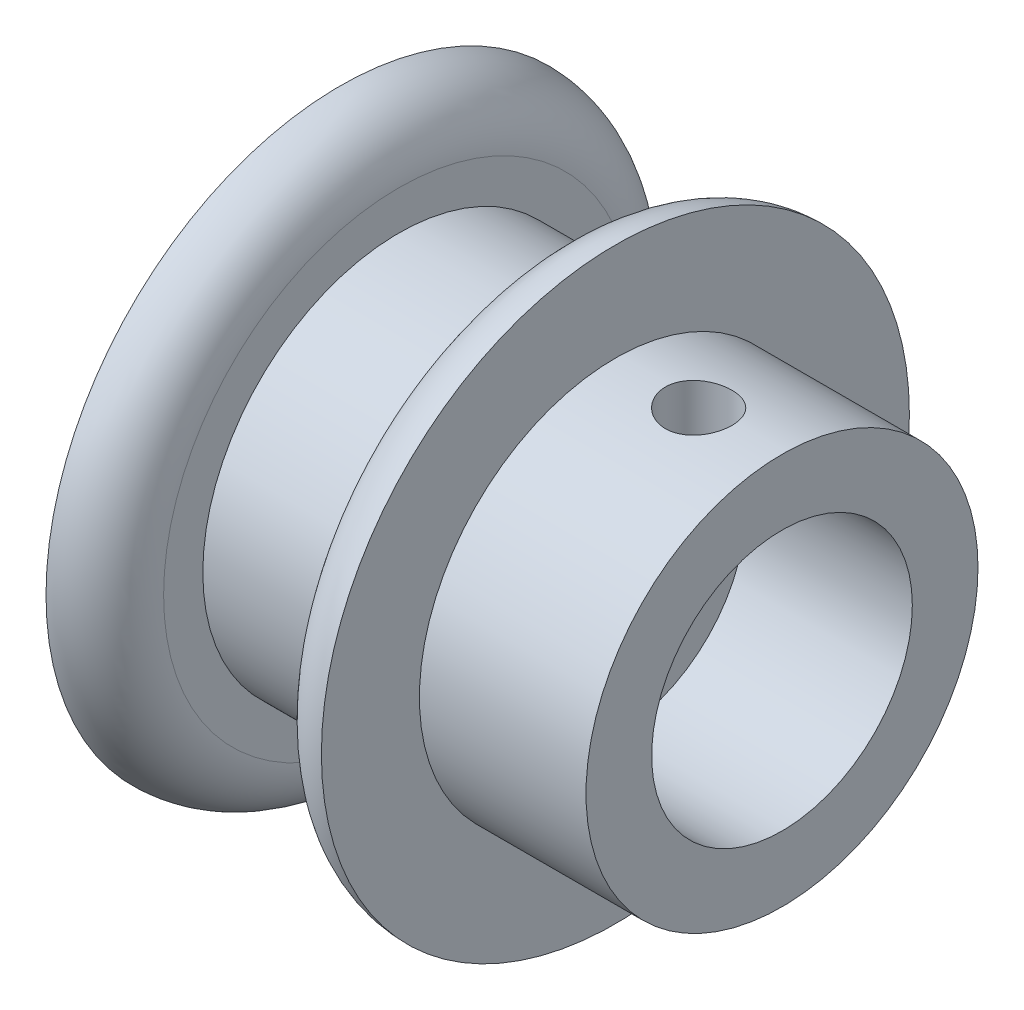
from build123d import *
from build123d.topology import SkipClean

# Parameters (mm, degrees)
EXTRUDE_3_DEPTH          = 14.35
EXTRUDE_START            = -3
EXTRUDE_7_DEPTH          = 3
EXTRUDE_8_DEPTH          = 3
EXTRUDE_START_2          = 10
EXTRUDE_9_DEPTH          = 10
EXTRUDE_10_DEPTH         = 10
CUT_EXTRUDE_1_DEPTH      = 10
CUT_EXTRUDE_2_DEPTH      = 14
FILLET_1_R               = 5
SKETCH_10_W              = 10.354719005
SKETCH_10_H              = 30
SKETCH_10_W_2            = 10.898600502
CUT_EXTRUDE_3_DEPTH      = 14
CUT_EXTRUDE_START        = -11.35
SKETCH_11_R              = 6.6
CUT_EXTRUDE_4_DEPTH      = 11.35
EXTRUDE_START_3          = -14.35
SKETCH_12_R              = 10
SKETCH_12_R_2            = 6.6
EXTRUDE_11_DEPTH         = 14.35
SKETCH_13_R              = 15
SKETCH_13_R_2            = 10
EXTRUDE_12_DEPTH         = 3
SKETCH_14_R              = 15
SKETCH_14_R_2            = 3.2
EXTRUDE_13_DEPTH         = 3
CUT_EXTRUDE_START_2      = -0.3
SKETCH_17_R              = 15
CUT_EXTRUDE_5_DEPTH      = 0.3
EXTRUDE_START_4          = 0.3
SKETCH_18_R              = 15
SKETCH_18_R_2            = 10
EXTRUDE_14_DEPTH         = 0.3
CUT_EXTRUDE_6_DEPTH      = 19.3
SKETCH_20_R              = 10
SKETCH_20_R_2            = 3.2
EXTRUDE_15_DEPTH         = 11.05
SKETCH_21_R              = 10
SKETCH_21_R_2            = 6.6
EXTRUDE_16_DEPTH         = 8.5
CUT_EXTRUDE_7_DEPTH      = 13.5
FILLET_2_R               = 3
CUT_EXTRUDE_9_DEPTH      = 10
CUT_EXTRUDE_9_DEPTH_BACK = 10
SKETCH_23_R              = 0.75
CUT_EXTRUDE_10_REACH     = 32.96
SKETCH_25_R              = 6.65


with BuildPart() as part:
    # Эскиз1 → Бобышка-Вытянуть3 (new body)
    with BuildSketch(Plane(origin=(0, 0, 0), x_dir=(0, 0, -1), z_dir=(1, 0, 0))):
        with BuildLine():
            ThreePointArc((-6.6, 0), (0, 6.6), (6.6, 0))
            Line((6.6, 0), (10, 0))
            ThreePointArc((10, 0), (0, 10), (-10, 0))
            Line((-10, 0), (-6.6, 0))
        make_face()
    extrude(amount=EXTRUDE_3_DEPTH)

    # Эскиз3 → Бобышка-Вытянуть7 (add)
    with BuildSketch(Plane(origin=(14.35, 0, 0), x_dir=(0, 0, -1), z_dir=(1, 0, 0)).offset(EXTRUDE_START)):
        with BuildLine():
            ThreePointArc((15, 0), (0, 15), (-15, 0))
            Line((-15, 0), (-10, 0))
            ThreePointArc((-10, 0), (0, 10), (10, 0))
            Line((10, 0), (15, 0))
        make_face()
        with BuildLine():
            ThreePointArc((6.6, 0), (0, 6.6), (-6.6, 0))
            Line((-6.6, 0), (-3.2, 0))
            ThreePointArc((-3.2, 0), (0, 3.2), (3.2, 0))
            Line((3.2, 0), (6.6, 0))
        make_face()
    extrude(amount=EXTRUDE_7_DEPTH)

    # Эскиз5 → Бобышка-Вытянуть8 (add)
    with BuildSketch(Plane.ZY):
        with BuildLine():
            ThreePointArc((15, 0), (0, 15), (-15, 0))
            Line((-15, 0), (-10, 0))
            ThreePointArc((-10, 0), (0, 10), (10, 0))
            Line((10, 0), (15, 0))
        make_face()
        with BuildLine():
            ThreePointArc((6.6, 0), (0, 6.6), (-6.6, 0))
            Line((-6.6, 0), (-3.2, 0))
            ThreePointArc((-3.2, 0), (0, 3.2), (3.2, 0))
            Line((3.2, 0), (6.6, 0))
        make_face()
    extrude(amount=-EXTRUDE_8_DEPTH)

    # Эскиз6 → Бобышка-Вытянуть9 (add)
    with BuildSketch(Plane.ZY.offset(EXTRUDE_START_2)):
        with BuildLine():
            ThreePointArc((-6.6, 0), (-6.41716127, 1.542738227), (-5.878775383, 3))
            Line((-5.878775383, 3), (-6.6, 3))
            Line((-6.6, 3), (-14.696938457, 3))
            Line((-14.696938457, 3), (-14.696938457, 0))
            Line((-14.696938457, 0), (-6.6, 0))
        make_face()
        with BuildLine():
            ThreePointArc((-3.2, 0), (-2.627105745, 1.827105745), (-1.113552873, 3))
            Line((-1.113552873, 3), (-5.878775383, 3))
            ThreePointArc((-5.878775383, 3), (-6.41716127, 1.542738227), (-6.6, 0))
            Line((-6.6, 0), (-3.2, 0))
        make_face()
        with BuildLine():
            Line((-5.878775383, 3), (-1.113552873, 3))
            ThreePointArc((-1.113552873, 3), (0, 3.2), (1.113552873, 3))
            Line((1.113552873, 3), (5.878775383, 3))
            ThreePointArc((5.878775383, 3), (0, 6.6), (-5.878775383, 3))
        make_face()
        with BuildLine():
            Line((5.878775383, 3), (1.113552873, 3))
            ThreePointArc((1.113552873, 3), (2.627105745, 1.827105745), (3.2, 0))
            Line((3.2, 0), (6.6, 0))
            ThreePointArc((6.6, 0), (6.41716127, 1.542738227), (5.878775383, 3))
        make_face()
        with BuildLine():
            Line((14.696938457, 3), (5.878775383, 3))
            ThreePointArc((5.878775383, 3), (6.41716127, 1.542738227), (6.6, 0))
            Line((6.6, 0), (14.696938457, 0))
            Line((14.696938457, 0), (14.696938457, 3))
        make_face()
    extrude(amount=-EXTRUDE_9_DEPTH)

    # Эскиз7 → Бобышка-Вытянуть10 (add)
    with BuildSketch(Plane(origin=(14.35, 0, 0), x_dir=(0, 0, -1), z_dir=(1, 0, 0))):
        with BuildLine():
            Line((6.6, 0), (14.696938457, 0))
            Line((14.696938457, 0), (14.696938457, 3))
            Line((14.696938457, 3), (5.878775383, 3))
            ThreePointArc((5.878775383, 3), (6.41716127, 1.542738227), (6.6, 0))
        make_face()
        with BuildLine():
            Line((3.2, 0), (6.6, 0))
            ThreePointArc((6.6, 0), (6.41716127, 1.542738227), (5.878775383, 3))
            ThreePointArc((5.878775383, 3), (0, 6.6), (-5.878775383, 3))
            ThreePointArc((-5.878775383, 3), (-6.41716127, 1.542738227), (-6.6, 0))
            Line((-6.6, 0), (-3.2, 0))
            ThreePointArc((-3.2, 0), (0, 3.2), (3.2, 0))
        make_face()
        with BuildLine():
            Line((-14.696938457, 0), (-6.6, 0))
            ThreePointArc((-6.6, 0), (-6.41716127, 1.542738227), (-5.878775383, 3))
            Line((-5.878775383, 3), (-14.696938457, 3))
            Line((-14.696938457, 3), (-14.696938457, 0))
        make_face()
    extrude(amount=EXTRUDE_10_DEPTH)

    # Эскиз8 → Вырез-Вытянуть1 (cut)
    with BuildSketch(Plane(origin=(0, 3, 0), x_dir=(1, 0, 0), z_dir=(0, 1, 0))):
        with BuildLine():
            ThreePointArc((-5, 11.98785692), (-6.7, 10.28785692), (-5, 8.58785692))
            Line((-5, 8.58785692), (-5, 11.98785692))
        make_face()
        with BuildLine():
            Line((-5, 11.98785692), (-5, 8.58785692))
            ThreePointArc((-5, 8.58785692), (-3.797918472, 9.085775392), (-3.3, 10.28785692))
            ThreePointArc((-3.3, 10.28785692), (-3.797918472, 11.489938448), (-5, 11.98785692))
        make_face()
        with BuildLine():
            ThreePointArc((21.05, 10.28785692), (20.552081528, 11.489938448), (19.35, 11.98785692))
            Line((19.35, 11.98785692), (19.35, 8.58785692))
            ThreePointArc((19.35, 8.58785692), (20.552081528, 9.085775392), (21.05, 10.28785692))
        make_face()
        with BuildLine():
            Line((19.35, 8.58785692), (19.35, 11.98785692))
            ThreePointArc((19.35, 11.98785692), (17.65, 10.28785692), (19.35, 8.58785692))
        make_face()
        with BuildLine():
            ThreePointArc((21.05, -10.28785692), (20.552081528, -9.085775392), (19.35, -8.58785692))
            Line((19.35, -8.58785692), (19.35, -11.98785692))
            ThreePointArc((19.35, -11.98785692), (20.552081528, -11.489938448), (21.05, -10.28785692))
        make_face()
        with BuildLine():
            Line((19.35, -11.98785692), (19.35, -8.58785692))
            ThreePointArc((19.35, -8.58785692), (17.65, -10.28785692), (19.35, -11.98785692))
        make_face()
        with BuildLine():
            ThreePointArc((-3.3, -10.28785692), (-3.797918472, -9.085775392), (-5, -8.58785692))
            Line((-5, -8.58785692), (-5, -11.98785692))
            ThreePointArc((-5, -11.98785692), (-3.797918472, -11.489938448), (-3.3, -10.28785692))
        make_face()
        with BuildLine():
            Line((-5, -11.98785692), (-5, -8.58785692))
            ThreePointArc((-5, -8.58785692), (-6.7, -10.28785692), (-5, -11.98785692))
        make_face()
    extrude(amount=-CUT_EXTRUDE_1_DEPTH, mode=Mode.SUBTRACT)

    # Эскиз9 → Вырез-Вытянуть2 (cut)
    with BuildSketch(Plane.XZ):
        with BuildLine():
            ThreePointArc((8.875, 0), (8.377081528, 1.202081528), (7.175, 1.7))
            Line((7.175, 1.7), (7.175, -1.7))
            ThreePointArc((7.175, -1.7), (8.377081528, -1.202081528), (8.875, 0))
        make_face()
        with BuildLine():
            Line((7.175, -1.7), (7.175, 1.7))
            ThreePointArc((7.175, 1.7), (5.475, 0), (7.175, -1.7))
        make_face()
    extrude(amount=-CUT_EXTRUDE_2_DEPTH, mode=Mode.SUBTRACT)

    # Скругление1
    fillet_1_edges = [part.edges().sort_by_distance(p)[0] for p in [
        (24.35, 1.5, -14.696938457),
        (-10, 1.5, 14.696938457),
        (-10, 1.5, -14.696938457),
        (24.35, 1.5, 14.696938457),
    ]]
    fillet(fillet_1_edges, radius=FILLET_1_R)

    # Эскиз10 → Вырез-Вытянуть3 (cut)
    with BuildSketch(Plane.XZ):
        with Locations((-5.177359503, 0)):
            Rectangle(SKETCH_10_W, SKETCH_10_H)
        with Locations((19.799300251, 0)):
            Rectangle(SKETCH_10_W_2, SKETCH_10_H)
    extrude(amount=-CUT_EXTRUDE_3_DEPTH, mode=Mode.SUBTRACT)

    # Эскиз11 → Вырез-Вытянуть4 (cut)
    with SkipClean():  # the faces are left unmerged after this step: merging them gives an invalid solid
        with BuildSketch(Plane(origin=(14.35, 0, 0), x_dir=(0, 0, -1), z_dir=(1, 0, 0)).offset(CUT_EXTRUDE_START)):
            Circle(SKETCH_11_R)
        extrude(amount=CUT_EXTRUDE_4_DEPTH, mode=Mode.SUBTRACT)

    # Эскиз12 → Бобышка-Вытянуть11 (add)
    with BuildSketch(Plane(origin=(14.35, 0, 0), x_dir=(0, 0, -1), z_dir=(1, 0, 0)).offset(EXTRUDE_START_3)):
        with Locations(Location((0, 0, 0), (0, 0, 180))):
            Circle(SKETCH_12_R)
        Circle(SKETCH_12_R_2, mode=Mode.SUBTRACT)
    extrude(amount=EXTRUDE_11_DEPTH)

    # Эскиз13 → Бобышка-Вытянуть12 (add)
    with BuildSketch(Plane(origin=(14.35, 0, 0), x_dir=(0, 0, -1), z_dir=(1, 0, 0)).offset(EXTRUDE_START)):
        Circle(SKETCH_13_R)
        Circle(SKETCH_13_R_2, mode=Mode.SUBTRACT)
    extrude(amount=EXTRUDE_12_DEPTH)

    # Эскиз14 → Бобышка-Вытянуть13 (add)
    with SkipClean():  # the faces are left unmerged after this step: merging them gives an invalid solid
        with BuildSketch(Plane.ZY):
            with Locations(Location((0, 0, 0), (0, 0, 180))):
                Circle(SKETCH_14_R)
            Circle(SKETCH_14_R_2, mode=Mode.SUBTRACT)
        extrude(amount=-EXTRUDE_13_DEPTH)

    # Эскиз17 → Вырез-Вытянуть5 (cut)
    with SkipClean():  # the faces are left unmerged after this step: merging them gives an invalid solid
        with BuildSketch(Plane(origin=(14.35, 0, 0), x_dir=(0, 0, -1), z_dir=(1, 0, 0)).offset(CUT_EXTRUDE_START_2)):
            Circle(SKETCH_17_R)
        extrude(amount=CUT_EXTRUDE_5_DEPTH, mode=Mode.SUBTRACT)

    # Эскиз18 → Бобышка-Вытянуть14 (add)
    with SkipClean():  # the faces are left unmerged after this step: merging them gives an invalid solid
        with BuildSketch(Plane.ZY.offset(-11.35).offset(EXTRUDE_START_4)):
            with Locations(Location((0, 0, 0), (0, 0, 180))):
                Circle(SKETCH_18_R)
            Circle(SKETCH_18_R_2, mode=Mode.SUBTRACT)
        extrude(amount=-EXTRUDE_14_DEPTH)

    # Эскиз19 → Вырез-Вытянуть6 (cut)
    with BuildSketch(Plane(origin=(0, 0, 0), x_dir=(1, 0, 0), z_dir=(0, 1, 0))):
        with BuildLine():
            ThreePointArc((8.725, 0), (7.025, 1.7), (5.325, 0))
            Line((5.325, 0), (8.725, 0))
        make_face()
        with BuildLine():
            Line((8.725, 0), (5.325, 0))
            ThreePointArc((5.325, 0), (7.025, -1.7), (8.725, 0))
        make_face()
    extrude(amount=CUT_EXTRUDE_6_DEPTH, mode=Mode.SUBTRACT)

    # Эскиз20 → Бобышка-Вытянуть15 (add)
    with BuildSketch(Plane(origin=(3, 0, 0), x_dir=(0, 0, -1), z_dir=(1, 0, 0))):
        with Locations(Location((0, 0, 0), (0, 0, 180))):
            Circle(SKETCH_20_R)
        Circle(SKETCH_20_R_2, mode=Mode.SUBTRACT)
    extrude(amount=EXTRUDE_15_DEPTH)

    # Эскиз21 → Бобышка-Вытянуть16 (add)
    with BuildSketch(Plane(origin=(14.05, 0, 0), x_dir=(0, 0, -1), z_dir=(1, 0, 0))):
        with Locations(Location((0, 0, 0), (0, 0, 180))):
            Circle(SKETCH_21_R)
        Circle(SKETCH_21_R_2, mode=Mode.SUBTRACT)
    extrude(amount=EXTRUDE_16_DEPTH)

    # Эскиз22 → Вырез-Вытянуть7 (cut)
    with BuildSketch(Plane(origin=(0, 0, 0), x_dir=(1, 0, 0), z_dir=(0, 1, 0))):
        with BuildLine():
            ThreePointArc((16.6, 0), (18.3, -1.7), (20, 0))
            Line((20, 0), (16.6, 0))
        make_face()
        with BuildLine():
            Line((16.6, 0), (20, 0))
            ThreePointArc((20, 0), (18.3, 1.7), (16.6, 0))
        make_face()
    extrude(amount=CUT_EXTRUDE_7_DEPTH, mode=Mode.SUBTRACT)

    # Скругление2
    fillet_2_edges = [part.edges().sort_by_distance(p)[0] for p in [
        (11.05, 0, 15),
        (3, 0, -15),
    ]]
    fillet(fillet_2_edges, radius=FILLET_2_R - 0.0001)  # a hair under: the kernel refuses the full size

    # Эскиз23 → Вырез-Вытянуть9 (cut, two sides: drawn at the far end of the back side and taken through both)
    with BuildSketch(Plane(origin=(0, 0, 0), x_dir=(1, 0, 0), z_dir=(0, 1, 0)).offset(-CUT_EXTRUDE_9_DEPTH_BACK)):
        with Locations(Location((7.025, 7, 0), (0, 0, 90))):
            Circle(SKETCH_23_R)
    extrude(amount=CUT_EXTRUDE_9_DEPTH + CUT_EXTRUDE_9_DEPTH_BACK, mode=Mode.SUBTRACT)

    # Вырез-Вытянуть10: up to this face of the body (flat: up to its plane)
    cut_extrude_10_end = Plane(part.part.faces().sort_by_distance((14.05, 0, 6.41332381))[0])
    # Эскиз25 → Вырез-Вытянуть10 (cut, up to the picked face)
    with BuildSketch(Plane(origin=(22.55, 0, 0), x_dir=(0, 0, -1), z_dir=(1, 0, 0)), mode=Mode.PRIVATE) as cut_extrude_10_sk1:
        Circle(SKETCH_25_R)
    cut_extrude_10_tool1 = split(extrude(cut_extrude_10_sk1.sketch, amount=-CUT_EXTRUDE_10_REACH, mode=Mode.PRIVATE), bisect_by=cut_extrude_10_end, keep=Keep.BOTH, mode=Mode.PRIVATE)
    add(cut_extrude_10_tool1.solids().sort_by(Axis((22.55, 0, 0), (-1, 0, 0)))[0], mode=Mode.SUBTRACT)


solid = part.part
